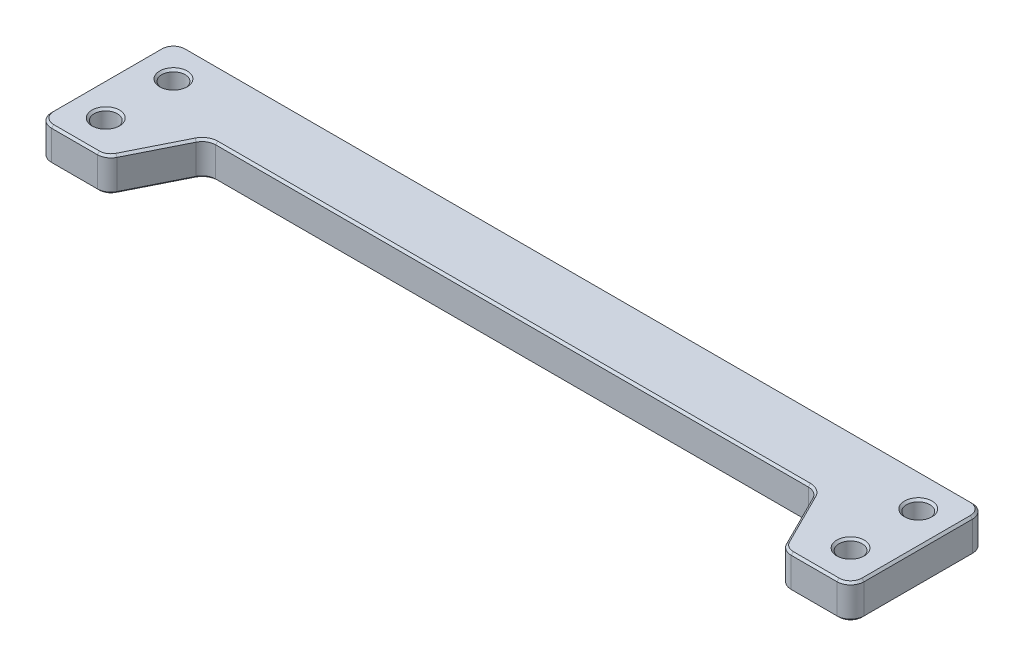
from build123d import *

# Parameters (mm, degrees)
SKETCH1_R           = 2.1828125
BOSS_EXTRUDE1_DEPTH = 6.35
CHAMFER1_SIZE       = 0.396875


with BuildPart() as part:
    # Sketch1 → Boss-Extrude1 (new body)
    with BuildSketch(Plane(origin=(0, 0, 0), x_dir=(1, 0, 0), z_dir=(0, 1, 0))):
        with BuildLine():
            Line((-3.81, 19.05), (143.51, 19.05))
            ThreePointArc((143.51, 19.05), (145.306051224, 18.306051224), (146.05, 16.51))
            Line((146.05, 16.51), (146.05, -3.81))
            ThreePointArc((146.05, -3.81), (145.306051224, -5.606051224), (143.51, -6.35))
            Line((143.51, -6.35), (134.919806331, -6.35))
            ThreePointArc((134.919806331, -6.35), (133.584449307, -5.970653053), (132.647961266, -4.945922533))
            Line((132.647961266, -4.945922533), (127.702038734, 4.945922533))
            ThreePointArc((127.702038734, 4.945922533), (126.765550693, 5.970653053), (125.430193669, 6.35))
            Line((125.430193669, 6.35), (14.269806331, 6.35))
            ThreePointArc((14.269806331, 6.35), (12.934449307, 5.970653053), (11.997961266, 4.945922533))
            Line((11.997961266, 4.945922533), (7.052038734, -4.945922533))
            ThreePointArc((7.052038734, -4.945922533), (6.115550693, -5.970653053), (4.780193669, -6.35))
            Line((4.780193669, -6.35), (-3.81, -6.35))
            ThreePointArc((-3.81, -6.35), (-5.606051224, -5.606051224), (-6.35, -3.81))
            Line((-6.35, -3.81), (-6.35, 16.51))
            ThreePointArc((-6.35, 16.51), (-5.606051224, 18.306051224), (-3.81, 19.05))
        make_face()
        Circle(SKETCH1_R, mode=Mode.SUBTRACT)
        with Locations((0, 12.7)):
            Circle(SKETCH1_R, mode=Mode.SUBTRACT)
        with Locations((139.7, 12.7)):
            Circle(SKETCH1_R, mode=Mode.SUBTRACT)
        with Locations((139.7, 0)):
            Circle(SKETCH1_R, mode=Mode.SUBTRACT)
    extrude(amount=BOSS_EXTRUDE1_DEPTH)

    # Chamfer1
    chamfer1_edges = [part.edges().sort_by_distance(p)[0] for p in [
        (137.5171875, 0, 0),
        (137.5171875, 0, -12.7),
        (-2.1828125, 0, -12.7),
        (-2.1828125, 0, 0),
        (130.175, 0, 0),
        (133.584449307, 0, 5.970653053),
        (139.214903166, 0, 6.35),
        (145.306051224, 0, 5.606051224),
        (146.05, 0, -6.35),
        (145.306051224, 0, -18.306051224),
        (69.85, 0, -19.05),
        (-5.606051224, 0, -18.306051224),
        (-6.35, 0, -6.35),
        (-5.606051224, 0, 5.606051224),
        (0.485096834, 0, 6.35),
        (6.115550693, 0, 5.970653053),
        (9.525, 0, 0),
        (12.934449307, 0, -5.970653053),
        (69.85, 0, -6.35),
        (126.765550693, 0, -5.970653053),
        (137.5171875, 6.35, 0),
        (-2.1828125, 6.35, -12.7),
        (69.85, 6.35, -6.35),
        (12.934449307, 6.35, -5.970653053),
        (9.525, 6.35, 0),
        (6.115550693, 6.35, 5.970653053),
        (0.485096834, 6.35, 6.35),
        (-5.606051224, 6.35, 5.606051224),
        (-6.35, 6.35, -6.35),
        (-5.606051224, 6.35, -18.306051224),
        (69.85, 6.35, -19.05),
        (145.306051224, 6.35, -18.306051224),
        (146.05, 6.35, -6.35),
        (145.306051224, 6.35, 5.606051224),
        (139.214903166, 6.35, 6.35),
        (133.584449307, 6.35, 5.970653053),
        (130.175, 6.35, 0),
        (126.765550693, 6.35, -5.970653053),
        (-2.1828125, 6.35, 0),
        (137.5171875, 6.35, -12.7),
    ]]
    chamfer(chamfer1_edges, length=CHAMFER1_SIZE)


solid = part.part
